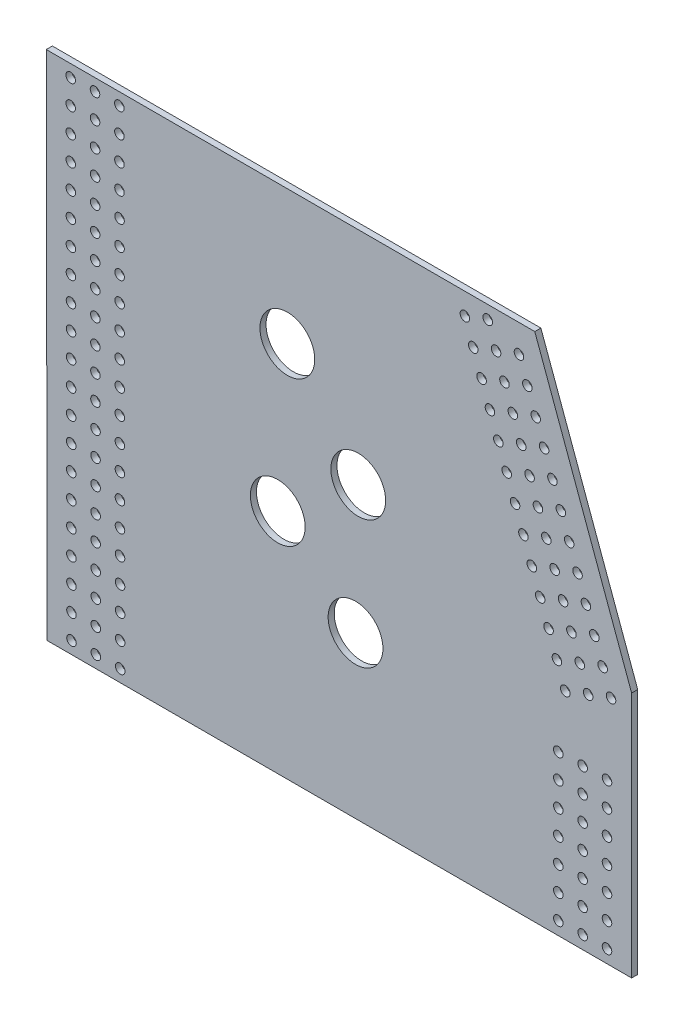
from build123d import *

# Parameters (mm, degrees)
SKETCH1_R           = 2.4892
SKETCH1_R_2         = 14.2875
SKETCH1_R_3         = 9.525
BOSS_EXTRUDE1_DEPTH = 3.175
BOSS_EXTRUDE2_START = -3.175
SKETCH2_R           = 29.21
SKETCH2_R_2         = 2.4892
BOSS_EXTRUDE2_DEPTH = 3.175


with BuildPart() as part:
    # Sketch1 → Boss-Extrude1 (new body)
    with BuildSketch(Plane.XY):
        Polygon((-0.025125332, 266.699618316), (254.730760226, 266.699618316), (305.237685121, 128.677945558), (305.237685121, 0), (0.437227099, 0), align=None)
        with Locations((25.385902159, 260.349618316)):
            Circle(SKETCH1_R, mode=Mode.SUBTRACT)
        with Locations((38.085902159, 260.349618316)):
            Circle(SKETCH1_R, mode=Mode.SUBTRACT)
        with Locations((25.40791894, 247.6496374)):
            Circle(SKETCH1_R, mode=Mode.SUBTRACT)
        with Locations((125.682623504, 196.681006469)):
            Circle(SKETCH1_R_2, mode=Mode.SUBTRACT)
        with Locations((162.671805282, 151.462682403)):
            Circle(SKETCH1_R_2, mode=Mode.SUBTRACT)
        with Locations((120.691047365, 118.561346157)):
            Circle(SKETCH1_R_2, mode=Mode.SUBTRACT)
        with Locations((161.250919953, 83.906995565)):
            Circle(SKETCH1_R_2, mode=Mode.SUBTRACT)
        with Locations((38.10791894, 247.6496374)):
            Circle(SKETCH1_R, mode=Mode.SUBTRACT)
        with Locations((12.685902159, 260.349618316)):
            Circle(SKETCH1_R, mode=Mode.SUBTRACT)
        with Locations((25.429935721, 234.949656484)):
            Circle(SKETCH1_R, mode=Mode.SUBTRACT)
        with Locations((38.129935721, 234.949656484)):
            Circle(SKETCH1_R, mode=Mode.SUBTRACT)
        with Locations((25.451952502, 222.249675568)):
            Circle(SKETCH1_R, mode=Mode.SUBTRACT)
        with Locations((38.151952502, 222.249675568)):
            Circle(SKETCH1_R, mode=Mode.SUBTRACT)
        with Locations((25.473969283, 209.549694653)):
            Circle(SKETCH1_R, mode=Mode.SUBTRACT)
        with Locations((38.173969283, 209.549694653)):
            Circle(SKETCH1_R, mode=Mode.SUBTRACT)
        with Locations((25.495986064, 196.849713737)):
            Circle(SKETCH1_R, mode=Mode.SUBTRACT)
        with Locations((38.195986064, 196.849713737)):
            Circle(SKETCH1_R, mode=Mode.SUBTRACT)
        with Locations((25.518002845, 184.149732821)):
            Circle(SKETCH1_R, mode=Mode.SUBTRACT)
        with Locations((38.218002845, 184.149732821)):
            Circle(SKETCH1_R, mode=Mode.SUBTRACT)
        with Locations((25.540019625, 171.449751905)):
            Circle(SKETCH1_R, mode=Mode.SUBTRACT)
        with Locations((38.240019625, 171.449751905)):
            Circle(SKETCH1_R, mode=Mode.SUBTRACT)
        with Locations((25.562036406, 158.749770989)):
            Circle(SKETCH1_R, mode=Mode.SUBTRACT)
        with Locations((38.262036406, 158.749770989)):
            Circle(SKETCH1_R, mode=Mode.SUBTRACT)
        with Locations((25.584053187, 146.049790074)):
            Circle(SKETCH1_R, mode=Mode.SUBTRACT)
        with Locations((38.284053187, 146.049790074)):
            Circle(SKETCH1_R, mode=Mode.SUBTRACT)
        with Locations((25.606069968, 133.349809158)):
            Circle(SKETCH1_R, mode=Mode.SUBTRACT)
        with Locations((38.306069968, 133.349809158)):
            Circle(SKETCH1_R, mode=Mode.SUBTRACT)
        with Locations((25.628086749, 120.649828242)):
            Circle(SKETCH1_R, mode=Mode.SUBTRACT)
        with Locations((38.328086749, 120.649828242)):
            Circle(SKETCH1_R, mode=Mode.SUBTRACT)
        with Locations((25.65010353, 107.949847326)):
            Circle(SKETCH1_R, mode=Mode.SUBTRACT)
        with Locations((38.35010353, 107.949847326)):
            Circle(SKETCH1_R, mode=Mode.SUBTRACT)
        with Locations((25.672120311, 95.249866411)):
            Circle(SKETCH1_R, mode=Mode.SUBTRACT)
        with Locations((38.372120311, 95.249866411)):
            Circle(SKETCH1_R, mode=Mode.SUBTRACT)
        with Locations((25.694137092, 82.549885495)):
            Circle(SKETCH1_R, mode=Mode.SUBTRACT)
        with Locations((38.394137092, 82.549885495)):
            Circle(SKETCH1_R, mode=Mode.SUBTRACT)
        with Locations((25.716153872, 69.849904579)):
            Circle(SKETCH1_R, mode=Mode.SUBTRACT)
        with Locations((38.416153872, 69.849904579)):
            Circle(SKETCH1_R, mode=Mode.SUBTRACT)
        with Locations((25.738170653, 57.149923663)):
            Circle(SKETCH1_R, mode=Mode.SUBTRACT)
        with Locations((38.438170653, 57.149923663)):
            Circle(SKETCH1_R, mode=Mode.SUBTRACT)
        with Locations((25.760187434, 44.449942747)):
            Circle(SKETCH1_R, mode=Mode.SUBTRACT)
        with Locations((38.460187434, 44.449942747)):
            Circle(SKETCH1_R, mode=Mode.SUBTRACT)
        with Locations((25.782204215, 31.749961832)):
            Circle(SKETCH1_R, mode=Mode.SUBTRACT)
        with Locations((38.482204215, 31.749961832)):
            Circle(SKETCH1_R, mode=Mode.SUBTRACT)
        with Locations((25.804220996, 19.049980916)):
            Circle(SKETCH1_R, mode=Mode.SUBTRACT)
        with Locations((38.504220996, 19.049980916)):
            Circle(SKETCH1_R, mode=Mode.SUBTRACT)
        with Locations((25.826237777, 6.35)):
            Circle(SKETCH1_R, mode=Mode.SUBTRACT)
        with Locations((38.526237777, 6.35)):
            Circle(SKETCH1_R, mode=Mode.SUBTRACT)
        with Locations((12.70791894, 247.6496374)):
            Circle(SKETCH1_R, mode=Mode.SUBTRACT)
        with Locations((12.729935721, 234.949656484)):
            Circle(SKETCH1_R, mode=Mode.SUBTRACT)
        with Locations((12.751952502, 222.249675568)):
            Circle(SKETCH1_R, mode=Mode.SUBTRACT)
        with Locations((12.773969283, 209.549694653)):
            Circle(SKETCH1_R, mode=Mode.SUBTRACT)
        with Locations((12.795986064, 196.849713737)):
            Circle(SKETCH1_R, mode=Mode.SUBTRACT)
        with Locations((12.818002845, 184.149732821)):
            Circle(SKETCH1_R, mode=Mode.SUBTRACT)
        with Locations((12.840019625, 171.449751905)):
            Circle(SKETCH1_R, mode=Mode.SUBTRACT)
        with Locations((12.862036406, 158.749770989)):
            Circle(SKETCH1_R, mode=Mode.SUBTRACT)
        with Locations((12.884053187, 146.049790074)):
            Circle(SKETCH1_R, mode=Mode.SUBTRACT)
        with Locations((12.906069968, 133.349809158)):
            Circle(SKETCH1_R, mode=Mode.SUBTRACT)
        with Locations((12.928086749, 120.649828242)):
            Circle(SKETCH1_R, mode=Mode.SUBTRACT)
        with Locations((12.95010353, 107.949847326)):
            Circle(SKETCH1_R, mode=Mode.SUBTRACT)
        with Locations((12.972120311, 95.249866411)):
            Circle(SKETCH1_R, mode=Mode.SUBTRACT)
        with Locations((12.994137092, 82.549885495)):
            Circle(SKETCH1_R, mode=Mode.SUBTRACT)
        with Locations((13.016153872, 69.849904579)):
            Circle(SKETCH1_R, mode=Mode.SUBTRACT)
        with Locations((13.038170653, 57.149923663)):
            Circle(SKETCH1_R, mode=Mode.SUBTRACT)
        with Locations((13.060187434, 44.449942747)):
            Circle(SKETCH1_R, mode=Mode.SUBTRACT)
        with Locations((13.082204215, 31.749961832)):
            Circle(SKETCH1_R, mode=Mode.SUBTRACT)
        with Locations((13.104220996, 19.049980916)):
            Circle(SKETCH1_R, mode=Mode.SUBTRACT)
        with Locations((13.126237777, 6.35)):
            Circle(SKETCH1_R, mode=Mode.SUBTRACT)
        with Locations((218.267087279, 255.47586689)):
            Circle(SKETCH1_R, mode=Mode.SUBTRACT)
        with Locations((222.631425579, 243.549318722)):
            Circle(SKETCH1_R, mode=Mode.SUBTRACT)
        with Locations((226.995763878, 231.622770554)):
            Circle(SKETCH1_R, mode=Mode.SUBTRACT)
        with Locations((231.360102178, 219.696222386)):
            Circle(SKETCH1_R, mode=Mode.SUBTRACT)
        with Locations((235.724440477, 207.769674217)):
            Circle(SKETCH1_R, mode=Mode.SUBTRACT)
        with Locations((240.088778777, 195.843126049)):
            Circle(SKETCH1_R, mode=Mode.SUBTRACT)
        with Locations((244.453117077, 183.916577881)):
            Circle(SKETCH1_R, mode=Mode.SUBTRACT)
        with Locations((248.817455376, 171.990029713)):
            Circle(SKETCH1_R, mode=Mode.SUBTRACT)
        with Locations((253.181793676, 160.063481545)):
            Circle(SKETCH1_R, mode=Mode.SUBTRACT)
        with Locations((257.546131975, 148.136933377)):
            Circle(SKETCH1_R, mode=Mode.SUBTRACT)
        with Locations((261.910470275, 136.210385209)):
            Circle(SKETCH1_R, mode=Mode.SUBTRACT)
        with Locations((266.274808574, 124.28383704)):
            Circle(SKETCH1_R, mode=Mode.SUBTRACT)
        with Locations((270.639146874, 112.357288872)):
            Circle(SKETCH1_R, mode=Mode.SUBTRACT)
        with Locations((230.193635447, 259.840205189)):
            Circle(SKETCH1_R, mode=Mode.SUBTRACT)
        with Locations((246.484521915, 252.277995321)):
            Circle(SKETCH1_R, mode=Mode.SUBTRACT)
        with Locations((234.557973747, 247.913657021)):
            Circle(SKETCH1_R, mode=Mode.SUBTRACT)
        with Locations((238.922312046, 235.987108853)):
            Circle(SKETCH1_R, mode=Mode.SUBTRACT)
        with Locations((243.286650346, 224.060560685)):
            Circle(SKETCH1_R, mode=Mode.SUBTRACT)
        with Locations((247.650988646, 212.134012517)):
            Circle(SKETCH1_R, mode=Mode.SUBTRACT)
        with Locations((252.015326945, 200.207464349)):
            Circle(SKETCH1_R, mode=Mode.SUBTRACT)
        with Locations((256.379665245, 188.280916181)):
            Circle(SKETCH1_R, mode=Mode.SUBTRACT)
        with Locations((260.744003544, 176.354368013)):
            Circle(SKETCH1_R, mode=Mode.SUBTRACT)
        with Locations((265.108341844, 164.427819844)):
            Circle(SKETCH1_R, mode=Mode.SUBTRACT)
        with Locations((269.472680143, 152.501271676)):
            Circle(SKETCH1_R, mode=Mode.SUBTRACT)
        with Locations((273.837018443, 140.574723508)):
            Circle(SKETCH1_R, mode=Mode.SUBTRACT)
        with Locations((278.201356743, 128.64817534)):
            Circle(SKETCH1_R, mode=Mode.SUBTRACT)
        with Locations((282.565695042, 116.721627172)):
            Circle(SKETCH1_R, mode=Mode.SUBTRACT)
        with Locations((250.848860215, 240.351447153)):
            Circle(SKETCH1_R, mode=Mode.SUBTRACT)
        with Locations((255.213198514, 228.424898985)):
            Circle(SKETCH1_R, mode=Mode.SUBTRACT)
        with Locations((259.577536814, 216.498350817)):
            Circle(SKETCH1_R, mode=Mode.SUBTRACT)
        with Locations((263.941875113, 204.571802648)):
            Circle(SKETCH1_R, mode=Mode.SUBTRACT)
        with Locations((268.306213413, 192.64525448)):
            Circle(SKETCH1_R, mode=Mode.SUBTRACT)
        with Locations((272.670551712, 180.718706312)):
            Circle(SKETCH1_R, mode=Mode.SUBTRACT)
        with Locations((277.034890012, 168.792158144)):
            Circle(SKETCH1_R, mode=Mode.SUBTRACT)
        with Locations((281.399228312, 156.865609976)):
            Circle(SKETCH1_R, mode=Mode.SUBTRACT)
        with Locations((285.763566611, 144.939061808)):
            Circle(SKETCH1_R, mode=Mode.SUBTRACT)
        with Locations((290.127904911, 133.01251364)):
            Circle(SKETCH1_R, mode=Mode.SUBTRACT)
        with Locations((294.49224321, 121.085965471)):
            Circle(SKETCH1_R, mode=Mode.SUBTRACT)
        with Locations((266.993755407, 82.990221112)):
            Circle(SKETCH1_R, mode=Mode.SUBTRACT)
        with Locations((279.693755407, 82.990221112)):
            Circle(SKETCH1_R, mode=Mode.SUBTRACT)
        with Locations((292.393755407, 82.990221112)):
            Circle(SKETCH1_R, mode=Mode.SUBTRACT)
        with Locations((279.693755407, 70.290221112)):
            Circle(SKETCH1_R, mode=Mode.SUBTRACT)
        with Locations((292.393755407, 70.290221112)):
            Circle(SKETCH1_R, mode=Mode.SUBTRACT)
        with Locations((279.693755407, 57.590221112)):
            Circle(SKETCH1_R, mode=Mode.SUBTRACT)
        with Locations((292.393755407, 57.590221112)):
            Circle(SKETCH1_R, mode=Mode.SUBTRACT)
        with Locations((279.693755407, 44.890221112)):
            Circle(SKETCH1_R, mode=Mode.SUBTRACT)
        with Locations((292.393755407, 44.890221112)):
            Circle(SKETCH1_R, mode=Mode.SUBTRACT)
        with Locations((279.693755407, 32.190221112)):
            Circle(SKETCH1_R, mode=Mode.SUBTRACT)
        with Locations((292.393755407, 32.190221112)):
            Circle(SKETCH1_R, mode=Mode.SUBTRACT)
        with Locations((279.693755407, 19.490221112)):
            Circle(SKETCH1_R, mode=Mode.SUBTRACT)
        with Locations((292.393755407, 19.490221112)):
            Circle(SKETCH1_R, mode=Mode.SUBTRACT)
        with Locations((279.693755407, 6.790221112)):
            Circle(SKETCH1_R, mode=Mode.SUBTRACT)
        with Locations((292.393755407, 6.790221112)):
            Circle(SKETCH1_R, mode=Mode.SUBTRACT)
        with Locations((266.993755407, 70.290221112)):
            Circle(SKETCH1_R, mode=Mode.SUBTRACT)
        with Locations((266.993755407, 57.590221112)):
            Circle(SKETCH1_R, mode=Mode.SUBTRACT)
        with Locations((266.993755407, 44.890221112)):
            Circle(SKETCH1_R, mode=Mode.SUBTRACT)
        with Locations((266.993755407, 32.190221112)):
            Circle(SKETCH1_R, mode=Mode.SUBTRACT)
        with Locations((266.993755407, 19.490221112)):
            Circle(SKETCH1_R, mode=Mode.SUBTRACT)
        with Locations((266.993755407, 6.790221112)):
            Circle(SKETCH1_R, mode=Mode.SUBTRACT)
        with Locations((196.048919953, 55.341109974)):
            Circle(SKETCH1_R_3, mode=Mode.SUBTRACT)
        with Locations((126.452919953, 55.341109974)):
            Circle(SKETCH1_R_3, mode=Mode.SUBTRACT)
        with Locations((221.448919953, 55.341109974)):
            Circle(SKETCH1_R, mode=Mode.SUBTRACT)
        with Locations((208.748919953, 33.344064718)):
            Circle(SKETCH1_R, mode=Mode.SUBTRACT)
        with Locations((183.348919953, 33.344064718)):
            Circle(SKETCH1_R, mode=Mode.SUBTRACT)
        with Locations((170.648919953, 55.341109974)):
            Circle(SKETCH1_R, mode=Mode.SUBTRACT)
        with Locations((183.348919953, 77.33815523)):
            Circle(SKETCH1_R, mode=Mode.SUBTRACT)
        with Locations((208.748919953, 77.33815523)):
            Circle(SKETCH1_R, mode=Mode.SUBTRACT)
        with Locations((101.052919953, 55.341109974)):
            Circle(SKETCH1_R, mode=Mode.SUBTRACT)
        with Locations((113.752919953, 77.33815523)):
            Circle(SKETCH1_R, mode=Mode.SUBTRACT)
        with Locations((139.152919953, 77.33815523)):
            Circle(SKETCH1_R, mode=Mode.SUBTRACT)
        with Locations((151.852919953, 55.341109974)):
            Circle(SKETCH1_R, mode=Mode.SUBTRACT)
        with Locations((139.152919953, 33.344064718)):
            Circle(SKETCH1_R, mode=Mode.SUBTRACT)
        with Locations((113.752919953, 33.344064718)):
            Circle(SKETCH1_R, mode=Mode.SUBTRACT)
        with Locations((179.316423254, 170.656016636)):
            Circle(SKETCH1_R, mode=Mode.SUBTRACT)
        with Locations((146.013408676, 132.295239531)):
            Circle(SKETCH1_R, mode=Mode.SUBTRACT)
    extrude(amount=BOSS_EXTRUDE1_DEPTH)

    # Sketch2 → Boss-Extrude2 (add)
    with BuildSketch(Plane.XY.offset(3.175).offset(BOSS_EXTRUDE2_START)):
        with Locations((126.452919953, 55.341109974)):
            Circle(SKETCH2_R)
        with Locations((196.048919953, 55.341109974)):
            Circle(SKETCH2_R)
        with Locations((179.316423254, 170.656016636)):
            Circle(SKETCH2_R_2)
        with Locations((146.013408676, 132.295239531)):
            Circle(SKETCH2_R_2)
    extrude(amount=BOSS_EXTRUDE2_DEPTH)


solid = part.part
